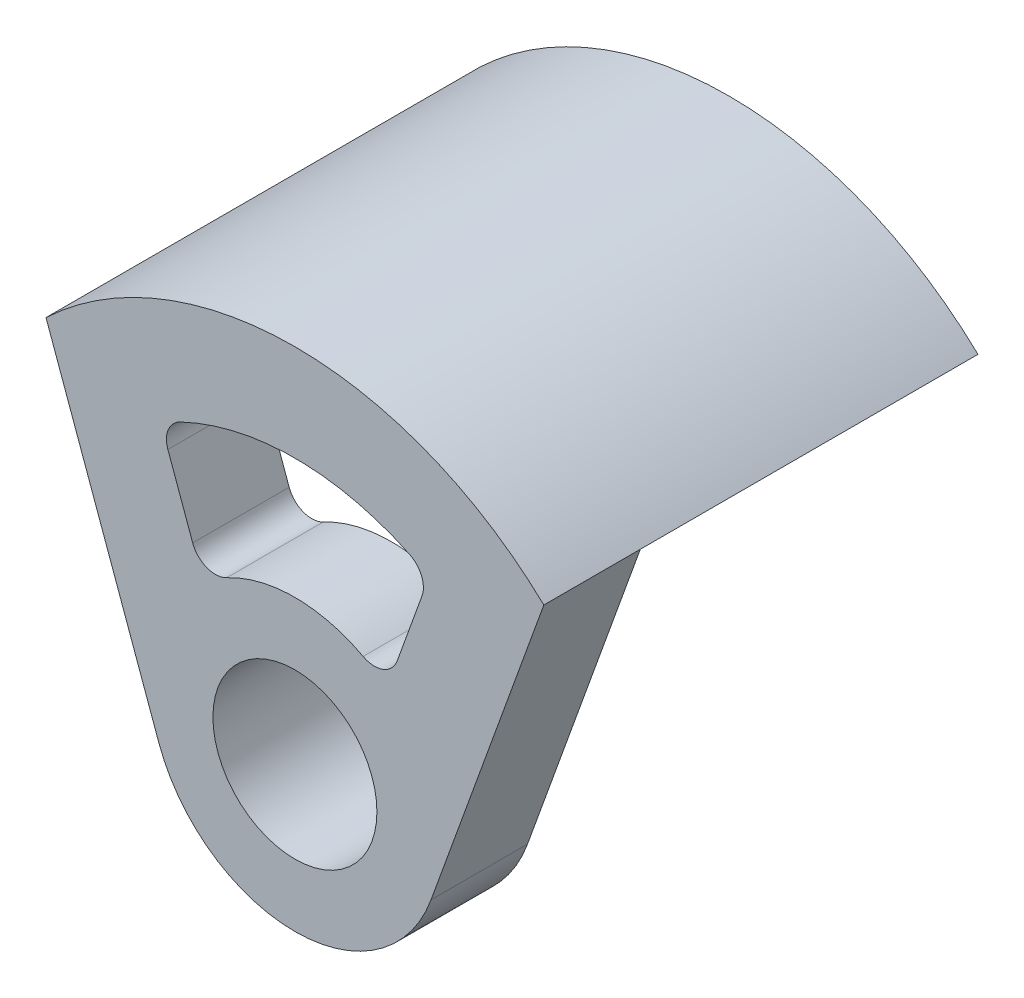
from build123d import *
from build123d.topology import SkipClean

# Parameters (mm, degrees)
BOSS_EXTRUDE1_DEPTH = 2
BOSS_EXTRUDE2_START = 5
BOSS_EXTRUDE2_DEPTH = 5
BOSS_EXTRUDE3_START = 2
SKETCH3_R           = 3
SKETCH3_R_2         = 1.7
BOSS_EXTRUDE3_DEPTH = 2
SKETCH4_R           = 2.2
SKETCH4_R_2         = 1.7
BOSS_EXTRUDE4_DEPTH = 0.5
CHAMFER1_SIZE       = 0.5
FILLET1_R           = 0.5


with BuildPart() as part:
    # Sketch1 → Boss-Extrude1 (new body)
    with BuildSketch(Plane.XY):
        with BuildLine():
            Line((4.594082841, 4.876925553), (5.159993549, 5.442836262))
            ThreePointArc((5.159993549, 5.442836262), (0, 7.5), (-5.159993549, 5.442836262))
            Line((-5.159993549, 5.442836262), (-4.594082841, 4.876925553))
            ThreePointArc((-4.594082841, 4.876925553), (0, 6.7), (4.594082841, 4.876925553))
        make_face()
    extrude(amount=-BOSS_EXTRUDE1_DEPTH)

    # Sketch1<3> → Boss-Extrude2 (add)
    with BuildSketch(Plane.XY.offset(BOSS_EXTRUDE2_START)):
        with BuildLine():
            Line((4.594082841, 4.876925553), (5.159993549, 5.442836262))
            ThreePointArc((5.159993549, 5.442836262), (0, 7.5), (-5.159993549, 5.442836262))
            Line((-5.159993549, 5.442836262), (-4.594082841, 4.876925553))
            ThreePointArc((-4.594082841, 4.876925553), (0, 6.7), (4.594082841, 4.876925553))
        make_face()
    extrude(amount=-BOSS_EXTRUDE2_DEPTH)

    # Sketch3 → Boss-Extrude3 (add)
    # profile 1 of 3: a face of its own
    with BuildSketch(Plane.XY.offset(5).offset(BOSS_EXTRUDE3_START)):
        with BuildLine():
            Line((-4.594082841, 4.876925553), (-5.159993549, 5.442836262))
            Line((-5.159993549, 5.442836262), (-2.820975701, -1.02083108))
            ThreePointArc((-2.820975701, -1.02083108), (-2.892694114, 0.795185994), (-1.902774006, 2.31936437))
            Line((-1.902774006, 2.31936437), (-2.780654635, 4.745309242))
            ThreePointArc((-2.780654635, 4.745309242), (0, 5.5), (2.780654635, 4.745309242))
            Line((2.780654635, 4.745309242), (1.902774006, 2.31936437))
            ThreePointArc((1.902774006, 2.31936437), (2.711855639, 1.282902565), (3, 0))
            ThreePointArc((3, 0), (2.954904999, -0.518205025), (2.820975701, -1.02083108))
            Line((2.820975701, -1.02083108), (5.159993549, 5.442836262))
            Line((5.159993549, 5.442836262), (4.594082841, 4.876925553))
            ThreePointArc((4.594082841, 4.876925553), (0, 6.7), (-4.594082841, 4.876925553))
        make_face()
    # profile 2 of 3: a face of its own
    with BuildSketch(Plane.XY.offset(5).offset(BOSS_EXTRUDE3_START)):
        with BuildLine():
            Line((-5.159993549, 5.442836262), (-4.594082841, 4.876925553))
            ThreePointArc((-4.594082841, 4.876925553), (0, 6.7), (4.594082841, 4.876925553))
            Line((4.594082841, 4.876925553), (5.159993549, 5.442836262))
            ThreePointArc((5.159993549, 5.442836262), (0, 7.5), (-5.159993549, 5.442836262))
        make_face()
    # profile 3 of 3: a face of its own
    with BuildSketch(Plane.XY.offset(5).offset(BOSS_EXTRUDE3_START)):
        Circle(SKETCH3_R)
        Circle(SKETCH3_R_2, mode=Mode.SUBTRACT)
    extrude(amount=-BOSS_EXTRUDE3_DEPTH)

    # Sketch4 → Boss-Extrude4 (add)
    with SkipClean():  # the faces are left unmerged after this step: merging them gives an invalid solid
        with BuildSketch(Plane(origin=(0, 0, 5), x_dir=(-1, 0, 0), z_dir=(0, 0, -1))):
            with Locations(Location((0, 0, 0), (0, 0, 180))):
                Circle(SKETCH4_R)
            Circle(SKETCH4_R_2, mode=Mode.SUBTRACT)
        extrude(amount=BOSS_EXTRUDE4_DEPTH)
    add(part.part.scale(1), mode=Mode.REPLACE)  # the faces are merged on a copy

    # Chamfer1
    chamfer1_edges = [part.edges().sort_by_distance(p)[0] for p in [
        (-2.2, 0, 5),
    ]]
    chamfer(chamfer1_edges, length=CHAMFER1_SIZE - 0.0001)  # a hair under: the kernel refuses the full size

    # Fillet1
    fillet1_edges = [part.edges().sort_by_distance(p)[0] for p in [
        (2.780654635, 4.745309242, 6),
        (1.902774006, 2.31936437, 6),
        (-1.902774006, 2.31936437, 6),
        (-2.780654635, 4.745309242, 6),
    ]]
    fillet(fillet1_edges, radius=FILLET1_R)


solid = part.part
